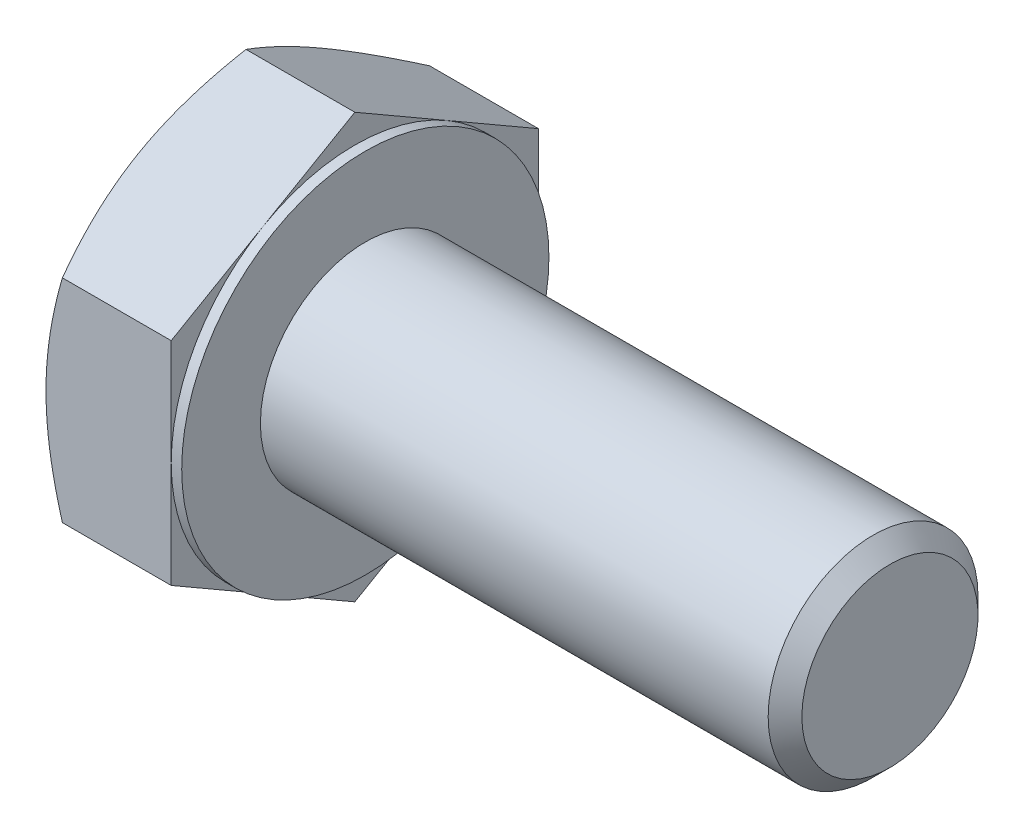
from build123d import *

# Parameters (mm, degrees)
BASEHEAD_DEPTH = 7.76
SKETCH4_W      = 0.6
SKETCH4_H      = 11.624355653


# Read off the part's stored shape, not the designer's step: HeadChamfer
with BuildPart() as part:
    # Sketch1 → BaseHead (new body)
    with BuildSketch(Plane(origin=(0, 0, 0), x_dir=(0, 0, -1), z_dir=(1, 0, 0))):
        Polygon((10.5, 6.062177826), (10.5, -6.062177826), (0, -12.124355653), (-10.5, -6.062177826), (-10.5, 6.062177826), (0, 12.124355653), align=None)
    extrude(amount=BASEHEAD_DEPTH)

    # HeadChamfer outline → HeadChamfer (revolve, cut)
    with BuildSketch(Plane.YX):
        Polygon((12.124355657, 0.937822176), (10.5, 0), (12.124355657, 0), align=None)
    revolve(axis=Axis((0, 0, 0), (1, 0, 0)), mode=Mode.SUBTRACT)

    # HeadChamfer 2 outline → HeadChamfer 2 (revolve)
    with BuildSketch(Plane.YX):
        Polygon((6, 7.76), (6, 36.796), (5.036, 37.76), (0, 37.76), (0, 7.76), align=None)
    revolve(axis=Axis((0, 0, 0), (1, 0, 0)))

    # Sketch4 → BearingFace (revolve, cut)
    with BuildSketch(Plane.XY, mode=Mode.PRIVATE) as bearingface_sk:
        with Locations((7.46, 16.312177827)):
            Rectangle(SKETCH4_W, SKETCH4_H)
    revolve(bearingface_sk.sketch.rotate(Axis((0, 0, 0), (1, 0, 0)), 90), axis=Axis((0, 0, 0), (1, 0, 0)), mode=Mode.SUBTRACT)


solid = part.part
